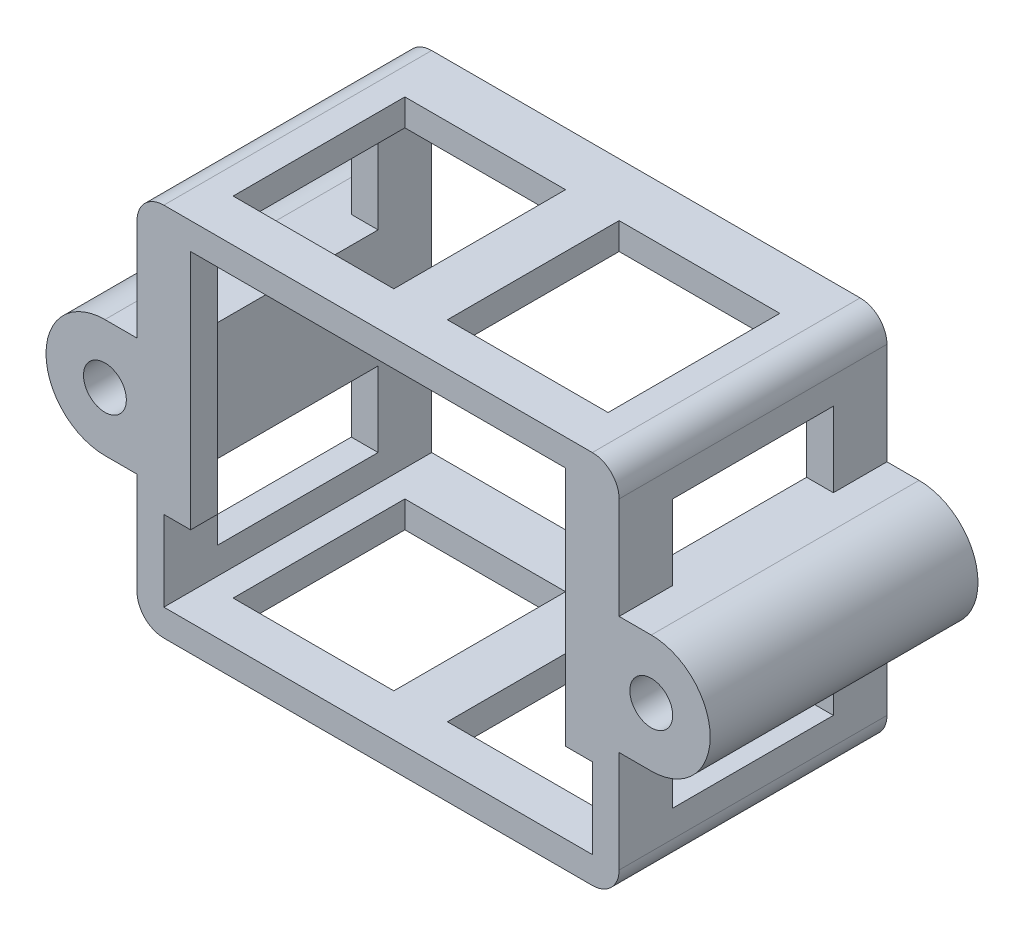
from build123d import *

# Parameters (mm, degrees)
SKETCH_2_W           = 18
SKETCH_2_H           = 14
EXTRUDE_1_DEPTH      = 4
SHELL_1_T            = -1
SKETCH_3_W           = 2.5
SKETCH_3_H           = 2
CUT_EXTRUDE_1_DEPTH  = 4
SKETCH_4_W           = 1.5
SKETCH_4_H           = 6
EXTRUDE_2_DEPTH      = 5
SKETCH_5_W           = 1.5
SKETCH_5_H           = 6
EXTRUDE_3_DEPTH      = 5
SKETCH_6_R           = 1.1
CUT_EXTRUDE_2_DEPTH  = 5
FILLET_1_R           = 3
SKETCH_7_W           = 5.917960412
SKETCH_7_H           = 8.297832083
CUT_EXTRUDE_3_DEPTH  = 10
SKETCH_8_R           = 0.7
EXTRUDE_5_DEPTH      = 3
SKETCH_9_W           = 5.283067479
SKETCH_9_H           = 7.875128382
CUT_EXTRUDE_6_DEPTH  = 3
SKETCH_10_R          = 0.7
EXTRUDE_6_DEPTH      = 3
SKETCH_11_R          = 0.7
EXTRUDE_7_DEPTH      = 1
FILLET_6_R           = 1
SKETCH_12_W          = 30.892671625
SKETCH_12_H          = 21.919086058
CUT_EXTRUDE_7_DEPTH  = 1
SKETCH_13_W          = 18
SKETCH_13_H          = 14
SKETCH_13_W_2        = 16
SKETCH_13_H_2        = 12
EXTRUDE_8_DEPTH      = 2
EXTRUDE_START        = 2
SKETCH_14_R          = 0.7
EXTRUDE_9_DEPTH      = 2
SKETCH_15_W          = 2
SKETCH_15_H          = 10
EXTRUDE_11_DEPTH     = 1
SKETCH_16_W          = 3
SKETCH_16_H          = 3
CUT_EXTRUDE_9_DEPTH  = 82.19627022
SKETCH_17_R          = 1.2
CUT_EXTRUDE_10_DEPTH = 89.625360281
SKETCH_18_W          = 18
SKETCH_18_H          = 14
SKETCH_18_W_2        = 16
SKETCH_18_H_2        = 12
EXTRUDE_12_DEPTH     = 10
SKETCH_19_R          = 1.2
SKETCH_19_R_2        = 0.8
EXTRUDE_14_DEPTH     = 5
SKETCH_20_R          = 0.8
EXTRUDE_15_DEPTH     = 10
SKETCH_21_W          = 2.939386231
SKETCH_21_H          = 10
SKETCH_21_W_2        = 3
SKETCH_21_W_3        = 3.044568854
CUT_EXTRUDE_11_DEPTH = 82.472905297
SKETCH_22_W          = 13
SKETCH_22_H          = 3.8
CUT_EXTRUDE_12_DEPTH = 45.806028471
SKETCH_23_W          = 27.889217439
SKETCH_23_H          = 16.978710397
CUT_EXTRUDE_13_DEPTH = 5
SKETCH_24_W          = 18
SKETCH_24_H          = 14
SKETCH_24_W_2        = 15.99
SKETCH_24_H_2        = 12
EXTRUDE_16_DEPTH     = 2
SKETCH_25_W          = 18
SKETCH_25_H          = 14
SKETCH_25_W_2        = 16
SKETCH_25_H_2        = 12.017260671
EXTRUDE_17_DEPTH     = 2
SKETCH_26_W          = 6
SKETCH_26_H          = 1
EXTRUDE_18_DEPTH     = 1
SKETCH_27_W          = 6
SKETCH_27_H          = 1
EXTRUDE_19_DEPTH     = 1.01
SKETCH_28_W          = 15.99
SKETCH_28_H          = 6
EXTRUDE_20_DEPTH     = 1
EXTRUDE_START_2      = -1
SKETCH_29_W          = 15.99
SKETCH_29_H          = 6
EXTRUDE_21_DEPTH     = 1
SKETCH_30_W          = 6
SKETCH_30_H          = 6.412534926
CUT_EXTRUDE_14_DEPTH = 82.19627022
FILLET_7_R           = 1


# Some blends are built 0.0001 mm under size
with BuildPart() as part:
    # Эскиз2 → Бобышка-Вытянуть1 (new body)
    with BuildSketch(Plane.XY):
        with Locations((-67.35483871, 31.322580645)):
            Rectangle(SKETCH_2_W, SKETCH_2_H)
    extrude(amount=EXTRUDE_1_DEPTH)

    # Оболочка1
    shell_1_openings = [part.faces().sort_by_distance(p)[0] for p in [
        (-67.35483871, 31.322580645, 4),
    ]]
    offset(amount=SHELL_1_T, openings=shell_1_openings, kind=Kind.INTERSECTION)

    # Эскиз3 → Вырез-Вытянуть1 (cut)
    with BuildSketch(Plane.XY.offset(1)):
        with Locations((-69.60483871, 36.322580645)):
            Rectangle(SKETCH_3_W, SKETCH_3_H)
        with Locations((-74.10483871, 36.322580645)):
            Rectangle(SKETCH_3_W, SKETCH_3_H)
        with Locations((-65.10483871, 36.322580645)):
            Rectangle(SKETCH_3_W, SKETCH_3_H)
        with Locations((-60.60483871, 36.322580645)):
            Rectangle(SKETCH_3_W, SKETCH_3_H)
        with Locations((-69.60483871, 32.992580645)):
            Rectangle(SKETCH_3_W, SKETCH_3_H)
        with Locations((-65.10483871, 32.992580645)):
            Rectangle(SKETCH_3_W, SKETCH_3_H)
        with Locations((-60.60483871, 32.992580645)):
            Rectangle(SKETCH_3_W, SKETCH_3_H)
        with Locations((-69.60483871, 29.662580645)):
            Rectangle(SKETCH_3_W, SKETCH_3_H)
        with Locations((-65.10483871, 29.662580645)):
            Rectangle(SKETCH_3_W, SKETCH_3_H)
        with Locations((-60.60483871, 29.662580645)):
            Rectangle(SKETCH_3_W, SKETCH_3_H)
        with Locations((-69.60483871, 26.332580645)):
            Rectangle(SKETCH_3_W, SKETCH_3_H)
        with Locations((-65.10483871, 26.332580645)):
            Rectangle(SKETCH_3_W, SKETCH_3_H)
        with Locations((-60.60483871, 26.332580645)):
            Rectangle(SKETCH_3_W, SKETCH_3_H)
        with Locations((-74.10483871, 32.992580645)):
            Rectangle(SKETCH_3_W, SKETCH_3_H)
        with Locations((-74.10483871, 29.662580645)):
            Rectangle(SKETCH_3_W, SKETCH_3_H)
        with Locations((-74.10483871, 26.332580645)):
            Rectangle(SKETCH_3_W, SKETCH_3_H)
    extrude(amount=-CUT_EXTRUDE_1_DEPTH, mode=Mode.SUBTRACT)

    # Эскиз4 → Бобышка-Вытянуть2 (add)
    with BuildSketch(Plane.ZY.offset(76.35483871)):
        with Locations((3.25, 31.322580645)):
            Rectangle(SKETCH_4_W, SKETCH_4_H)
    extrude(amount=EXTRUDE_2_DEPTH)

    # Эскиз5 → Бобышка-Вытянуть3 (add)
    with BuildSketch(Plane(origin=(-58.35483871, 0, 0), x_dir=(0, 0, -1), z_dir=(1, 0, 0))):
        with Locations((-3.25, 31.322580645)):
            Rectangle(SKETCH_5_W, SKETCH_5_H)
    extrude(amount=EXTRUDE_3_DEPTH)

    # Эскиз6 → Вырез-Вытянуть2 (cut)
    with BuildSketch(Plane(origin=(0, 0, 2.5), x_dir=(-1, 0, 0), z_dir=(0, 0, -1))):
        with Locations(Location((55.85483871, 31.322580645, 0), (0, 0, 90))):
            Circle(SKETCH_6_R)
        with Locations(Location((78.85483871, 31.322580645, 0), (0, 0, 90))):
            Circle(SKETCH_6_R)
    extrude(amount=-CUT_EXTRUDE_2_DEPTH, mode=Mode.SUBTRACT)

    # Скругление1
    fillet_1_edges = [part.edges().sort_by_distance(p)[0] for p in [
        (-81.35483871, 28.322580645, 3.25),
        (-81.35483871, 34.322580645, 3.25),
        (-53.35483871, 28.322580645, 3.25),
        (-53.35483871, 34.322580645, 3.25),
    ]]
    fillet(fillet_1_edges, radius=FILLET_1_R - 0.0001)  # a hair under: the kernel refuses the full size

    # Эскиз7 → Вырез-Вытянуть3 (cut)
    with BuildSketch(Plane.XY.offset(4)):
        with Locations((-79.313818916, 31.798685765)):
            Rectangle(SKETCH_7_W, SKETCH_7_H)
    extrude(amount=-CUT_EXTRUDE_3_DEPTH, mode=Mode.SUBTRACT)

    # Эскиз8 → Бобышка-Вытянуть5 (add)
    with BuildSketch(Plane.XY.offset(4)):
        with BuildLine():
            Line((-77.55483871, 33.522580645), (-76.35483871, 33.522580645))
            Line((-76.35483871, 33.522580645), (-76.35483871, 29.122580645))
            Line((-76.35483871, 29.122580645), (-77.55483871, 29.122580645))
            ThreePointArc((-77.55483871, 29.122580645), (-79.75483871, 31.322580645), (-77.55483871, 33.522580645))
        make_face()
        with Locations((-77.55483871, 31.322580645)):
            Circle(SKETCH_8_R, mode=Mode.SUBTRACT)
    extrude(amount=-EXTRUDE_5_DEPTH)

    # Эскиз9 → Вырез-Вытянуть6 (cut)
    with BuildSketch(Plane.XY.offset(4)):
        with Locations((-55.713304971, 31.190086721)):
            Rectangle(SKETCH_9_W, SKETCH_9_H)
    extrude(amount=-CUT_EXTRUDE_6_DEPTH, mode=Mode.SUBTRACT)

    # Эскиз10 → Бобышка-Вытянуть6 (add)
    with BuildSketch(Plane.XY.offset(4)):
        with BuildLine():
            Line((-57.15483871, 33.522580645), (-58.35483871, 33.522580645))
            Line((-58.35483871, 33.522580645), (-58.35483871, 29.122580645))
            Line((-58.35483871, 29.122580645), (-57.15483871, 29.122580645))
            ThreePointArc((-57.15483871, 29.122580645), (-54.95483871, 31.322580645), (-57.15483871, 33.522580645))
        make_face()
        with Locations((-57.15483871, 31.322580645)):
            Circle(SKETCH_10_R, mode=Mode.SUBTRACT)
    extrude(amount=-EXTRUDE_6_DEPTH)

    # Эскиз11 → Бобышка-Вытянуть7 (add)
    # profile 1 of 2: a face of its own
    with BuildSketch(Plane(origin=(0, 0, 1), x_dir=(-1, 0, 0), z_dir=(0, 0, -1))):
        with BuildLine():
            Line((57.15483871, 33.522580645), (58.35483871, 33.522580645))
            Line((58.35483871, 33.522580645), (58.35483871, 29.122580645))
            Line((58.35483871, 29.122580645), (57.15483871, 29.122580645))
            ThreePointArc((57.15483871, 29.122580645), (54.95483871, 31.322580645), (57.15483871, 33.522580645))
        make_face()
        with Locations(Location((57.15483871, 31.322580645, 0), (0, 0, 180))):
            Circle(SKETCH_11_R, mode=Mode.SUBTRACT)
    # profile 2 of 2: a face of its own
    with BuildSketch(Plane(origin=(0, 0, 1), x_dir=(-1, 0, 0), z_dir=(0, 0, -1))):
        with BuildLine():
            Line((77.55483871, 33.522580645), (76.35483871, 33.522580645))
            Line((76.35483871, 33.522580645), (76.35483871, 29.122580645))
            Line((76.35483871, 29.122580645), (77.55483871, 29.122580645))
            ThreePointArc((77.55483871, 29.122580645), (79.75483871, 31.322580645), (77.55483871, 33.522580645))
        make_face()
        with Locations(Location((77.55483871, 31.322580645, 0), (0, 0, 180))):
            Circle(SKETCH_11_R, mode=Mode.SUBTRACT)
    extrude(amount=EXTRUDE_7_DEPTH)

    # Скругление6
    # the kernel refuses this fillet: 1 mm, written as the material it takes off along each edge
    with BuildSketch(Plane(origin=(-76.35483871, 29.122580645, 0), x_dir=(1, 0, 0), z_dir=(0, -1, 0))) as fillet_6_piece_1:
        with BuildLine():
            CenterArc((FILLET_6_R, FILLET_6_R), FILLET_6_R, 180, 90)
            Line((0, FILLET_6_R), (-FILLET_6_R * 0.02, FILLET_6_R))
            Line((-FILLET_6_R * 0.02, FILLET_6_R), (-FILLET_6_R * 0.02, -FILLET_6_R * 0.02))
            Line((-FILLET_6_R * 0.02, -FILLET_6_R * 0.02), (FILLET_6_R, -FILLET_6_R * 0.02))
            Line((FILLET_6_R, -FILLET_6_R * 0.02), (FILLET_6_R, 0))
        make_face()
    extrude(amount=4.8, mode=Mode.SUBTRACT)
    with BuildSketch(Plane(origin=(-77.55483871, 31.322580645, 0), x_dir=(0, -1, 0), z_dir=(1, 0, 0))) as fillet_6_piece_2:
        with BuildLine():
            CenterArc((2.2 - FILLET_6_R, -FILLET_6_R), FILLET_6_R, 0, 90)
            Line((2.2, -FILLET_6_R), (2.2 + FILLET_6_R * 0.02, -FILLET_6_R))
            Line((2.2 + FILLET_6_R * 0.02, -FILLET_6_R), (2.2 + FILLET_6_R * 0.02, FILLET_6_R * 0.02))
            Line((2.2 + FILLET_6_R * 0.02, FILLET_6_R * 0.02), (2.2 - FILLET_6_R, FILLET_6_R * 0.02))
            Line((2.2 - FILLET_6_R, FILLET_6_R * 0.02), (2.2 - FILLET_6_R, 0))
        make_face()
    revolve(axis=Axis((-77.55483871, 31.322580645, 0), (0, 0, -1)), revolution_arc=180, mode=Mode.SUBTRACT)
    with BuildSketch(Plane(origin=(-77.55483871, 33.522580645, 0), x_dir=(0, -1, 0), z_dir=(1, 0, 0)), Plane(origin=(-76.35483871, 29.122580645, 0), x_dir=(0, 1, 0), z_dir=(-1, 0, 0))) as fillet_6_piece_3:
        with BuildLine():
            CenterArc((FILLET_6_R, -FILLET_6_R), FILLET_6_R, 90, 90)
            Line((0, -FILLET_6_R), (-FILLET_6_R * 0.02, -FILLET_6_R))
            Line((-FILLET_6_R * 0.02, -FILLET_6_R), (-FILLET_6_R * 0.02, FILLET_6_R * 0.02))
            Line((-FILLET_6_R * 0.02, FILLET_6_R * 0.02), (FILLET_6_R, FILLET_6_R * 0.02))
            Line((FILLET_6_R, FILLET_6_R * 0.02), (FILLET_6_R, 0))
        make_face()
    extrude(amount=1.2, mode=Mode.SUBTRACT)
    with BuildSketch(Plane(origin=(-58.35483871, 38.322580645, 0), x_dir=(-1, 0, 0), z_dir=(0, -1, 0))) as fillet_6_piece_4:
        with BuildLine():
            CenterArc((FILLET_6_R, -FILLET_6_R), FILLET_6_R, 90, 90)
            Line((0, -FILLET_6_R), (-FILLET_6_R * 0.02, -FILLET_6_R))
            Line((-FILLET_6_R * 0.02, -FILLET_6_R), (-FILLET_6_R * 0.02, FILLET_6_R * 0.02))
            Line((-FILLET_6_R * 0.02, FILLET_6_R * 0.02), (FILLET_6_R, FILLET_6_R * 0.02))
            Line((FILLET_6_R, FILLET_6_R * 0.02), (FILLET_6_R, 0))
        make_face()
    extrude(amount=4.8, mode=Mode.SUBTRACT)
    with BuildSketch(Plane(origin=(-57.15483871, 31.322580645, 0), x_dir=(0, -1, 0), z_dir=(-1, 0, 0))) as fillet_6_piece_5:
        with BuildLine():
            CenterArc((2.2 - FILLET_6_R, FILLET_6_R), FILLET_6_R, 270, 90)
            Line((2.2, FILLET_6_R), (2.2 + FILLET_6_R * 0.02, FILLET_6_R))
            Line((2.2 + FILLET_6_R * 0.02, FILLET_6_R), (2.2 + FILLET_6_R * 0.02, -FILLET_6_R * 0.02))
            Line((2.2 + FILLET_6_R * 0.02, -FILLET_6_R * 0.02), (2.2 - FILLET_6_R, -FILLET_6_R * 0.02))
            Line((2.2 - FILLET_6_R, -FILLET_6_R * 0.02), (2.2 - FILLET_6_R, 0))
        make_face()
    revolve(axis=Axis((-57.15483871, 31.322580645, 0), (0, 0, 1)), revolution_arc=180, mode=Mode.SUBTRACT)
    with BuildSketch(Plane(origin=(-58.35483871, 29.122580645, 0), x_dir=(0, 1, 0), z_dir=(1, 0, 0)), Plane(origin=(-57.15483871, 33.522580645, 0), x_dir=(0, -1, 0), z_dir=(-1, 0, 0))) as fillet_6_piece_6:
        with BuildLine():
            CenterArc((FILLET_6_R, FILLET_6_R), FILLET_6_R, 180, 90)
            Line((0, FILLET_6_R), (-FILLET_6_R * 0.02, FILLET_6_R))
            Line((-FILLET_6_R * 0.02, FILLET_6_R), (-FILLET_6_R * 0.02, -FILLET_6_R * 0.02))
            Line((-FILLET_6_R * 0.02, -FILLET_6_R * 0.02), (FILLET_6_R, -FILLET_6_R * 0.02))
            Line((FILLET_6_R, -FILLET_6_R * 0.02), (FILLET_6_R, 0))
        make_face()
    extrude(amount=1.2, mode=Mode.SUBTRACT)
    with BuildSketch(Plane(origin=(-76.35483871, 31.622580645, 0), x_dir=(1, 0, 0), z_dir=(0, -1, 0))) as fillet_6_piece_7a_section:
        with BuildLine():
            CenterArc((FILLET_6_R, FILLET_6_R), FILLET_6_R, 180, 90)
            Line((0, FILLET_6_R), (-FILLET_6_R * 0.02, FILLET_6_R))
            Line((-FILLET_6_R * 0.02, FILLET_6_R), (-FILLET_6_R * 0.02, -FILLET_6_R * 0.02))
            Line((-FILLET_6_R * 0.02, -FILLET_6_R * 0.02), (FILLET_6_R, -FILLET_6_R * 0.02))
            Line((FILLET_6_R, -FILLET_6_R * 0.02), (FILLET_6_R, 0))
        make_face()
    fillet_6_piece_7a = extrude(amount=7.3, mode=Mode.PRIVATE)
    fillet_6_piece_7a = split(fillet_6_piece_7a, bisect_by=Plane(origin=(-76.128443595, 29.122580645, 0.226395114), z_dir=(0, 1, 0)), keep=Keep.TOP, mode=Mode.PRIVATE)
    with BuildSketch(Plane(origin=(-73.85483871, 29.122580645, 0), x_dir=(0, 1, 0), z_dir=(-1, 0, 0))) as fillet_6_piece_7b_section:
        with BuildLine():
            CenterArc((FILLET_6_R, -FILLET_6_R), FILLET_6_R, 90, 90)
            Line((0, -FILLET_6_R), (-FILLET_6_R * 0.02, -FILLET_6_R))
            Line((-FILLET_6_R * 0.02, -FILLET_6_R), (-FILLET_6_R * 0.02, FILLET_6_R * 0.02))
            Line((-FILLET_6_R * 0.02, FILLET_6_R * 0.02), (FILLET_6_R, FILLET_6_R * 0.02))
            Line((FILLET_6_R, FILLET_6_R * 0.02), (FILLET_6_R, 0))
        make_face()
    fillet_6_piece_7b = extrude(amount=3.7, mode=Mode.PRIVATE)
    fillet_6_piece_7b = split(fillet_6_piece_7b, bisect_by=Plane(origin=(-76.35483871, 29.348975759, 0.226395114), z_dir=(1, 0, 0)), keep=Keep.TOP, mode=Mode.PRIVATE)
    fillet_6_piece_7 = fillet_6_piece_7a & fillet_6_piece_7b
    add(fillet_6_piece_7, mode=Mode.SUBTRACT)
    with BuildSketch(Plane(origin=(-57.15483871, 33.522580645, 0), x_dir=(0, -1, 0), z_dir=(-1, 0, 0))) as fillet_6_piece_8a_section:
        with BuildLine():
            CenterArc((FILLET_6_R, FILLET_6_R), FILLET_6_R, 180, 90)
            Line((0, FILLET_6_R), (-FILLET_6_R * 0.02, FILLET_6_R))
            Line((-FILLET_6_R * 0.02, FILLET_6_R), (-FILLET_6_R * 0.02, -FILLET_6_R * 0.02))
            Line((-FILLET_6_R * 0.02, -FILLET_6_R * 0.02), (FILLET_6_R, -FILLET_6_R * 0.02))
            Line((FILLET_6_R, -FILLET_6_R * 0.02), (FILLET_6_R, 0))
        make_face()
    fillet_6_piece_8a = extrude(amount=3.7, mode=Mode.PRIVATE)
    fillet_6_piece_8a = split(fillet_6_piece_8a, bisect_by=Plane(origin=(-58.35483871, 33.296185531, 0.226395114), z_dir=(-1, 0, 0)), keep=Keep.TOP, mode=Mode.PRIVATE)
    with BuildSketch(Plane(origin=(-58.35483871, 38.322580645, 0), x_dir=(-1, 0, 0), z_dir=(0, -1, 0))) as fillet_6_piece_8b_section:
        with BuildLine():
            CenterArc((FILLET_6_R, -FILLET_6_R), FILLET_6_R, 90, 90)
            Line((0, -FILLET_6_R), (-FILLET_6_R * 0.02, -FILLET_6_R))
            Line((-FILLET_6_R * 0.02, -FILLET_6_R), (-FILLET_6_R * 0.02, FILLET_6_R * 0.02))
            Line((-FILLET_6_R * 0.02, FILLET_6_R * 0.02), (FILLET_6_R, FILLET_6_R * 0.02))
            Line((FILLET_6_R, FILLET_6_R * 0.02), (FILLET_6_R, 0))
        make_face()
    fillet_6_piece_8b = extrude(amount=7.3, mode=Mode.PRIVATE)
    fillet_6_piece_8b = split(fillet_6_piece_8b, bisect_by=Plane(origin=(-58.581233824, 33.522580645, 0.226395114), z_dir=(0, -1, 0)), keep=Keep.TOP, mode=Mode.PRIVATE)
    fillet_6_piece_8 = fillet_6_piece_8a & fillet_6_piece_8b
    add(fillet_6_piece_8, mode=Mode.SUBTRACT)

    # Эскиз12 → Вырез-Вытянуть7 (cut)
    with BuildSketch(Plane(origin=(0, 0, 0), x_dir=(-1, 0, 0), z_dir=(0, 0, -1))):
        with Locations((68.526392305, 30.136365087)):
            Rectangle(SKETCH_12_W, SKETCH_12_H)
    extrude(amount=-CUT_EXTRUDE_7_DEPTH, mode=Mode.SUBTRACT)

    # Эскиз13 → Бобышка-Вытянуть8 (add)
    with BuildSketch(Plane.XY.offset(4)):
        with Locations((-67.35483871, 31.322580645)):
            Rectangle(SKETCH_13_W, SKETCH_13_H)
        with Locations((-67.35483871, 31.322580645)):
            Rectangle(SKETCH_13_W_2, SKETCH_13_H_2, mode=Mode.SUBTRACT)
    extrude(amount=EXTRUDE_8_DEPTH)

    # Эскиз14 → Бобышка-Вытянуть9 (add)
    # profile 1 of 2: a face of its own
    with BuildSketch(Plane.XY.offset(4).offset(EXTRUDE_START)):
        with BuildLine():
            Line((-77.55483871, 33.522580645), (-76.35483871, 33.522580645))
            Line((-76.35483871, 33.522580645), (-76.35483871, 29.122580645))
            Line((-76.35483871, 29.122580645), (-77.55483871, 29.122580645))
            ThreePointArc((-77.55483871, 29.122580645), (-79.75483871, 31.322580645), (-77.55483871, 33.522580645))
        make_face()
        with Locations((-77.55483871, 31.322580645)):
            Circle(SKETCH_14_R, mode=Mode.SUBTRACT)
    # profile 2 of 2: a face of its own
    with BuildSketch(Plane.XY.offset(4).offset(EXTRUDE_START)):
        with BuildLine():
            Line((-57.15483871, 33.522580645), (-58.35483871, 33.522580645))
            Line((-58.35483871, 33.522580645), (-58.35483871, 29.122580645))
            Line((-58.35483871, 29.122580645), (-57.15483871, 29.122580645))
            ThreePointArc((-57.15483871, 29.122580645), (-54.95483871, 31.322580645), (-57.15483871, 33.522580645))
        make_face()
        with Locations((-57.15483871, 31.322580645)):
            Circle(SKETCH_14_R, mode=Mode.SUBTRACT)
    extrude(amount=-EXTRUDE_9_DEPTH)

    # Эскиз15 → Бобышка-Вытянуть11 (add)
    with BuildSketch(Plane.XY.offset(6)):
        with Locations((-59.35483871, 33.322580645)):
            Rectangle(SKETCH_15_W, SKETCH_15_H)
        with Locations((-75.35483871, 33.322580645)):
            Rectangle(SKETCH_15_W, SKETCH_15_H)
    extrude(amount=-EXTRUDE_11_DEPTH)

    # Эскиз16 → Вырез-Вытянуть9 (cut, through all)
    with BuildSketch(Plane(origin=(0, 38.322580645, 0), x_dir=(1, 0, 0), z_dir=(0, 1, 0))):
        with Locations((-73.85483871, -3.5)):
            Rectangle(SKETCH_16_W, SKETCH_16_H)
        with Locations((-69.52483871, -3.5)):
            Rectangle(SKETCH_16_W, SKETCH_16_H)
        with Locations((-65.19483871, -3.5)):
            Rectangle(SKETCH_16_W, SKETCH_16_H)
        with Locations((-60.86483871, -3.5)):
            Rectangle(SKETCH_16_W, SKETCH_16_H)
    extrude(amount=-CUT_EXTRUDE_9_DEPTH, mode=Mode.SUBTRACT)

    # Эскиз17 → Вырез-Вытянуть10 (cut, through all)
    with BuildSketch(Plane(origin=(0, 0, 1), x_dir=(-1, 0, 0), z_dir=(0, 0, -1))):
        with Locations((57.15483871, 31.322580645)):
            Circle(SKETCH_17_R)
        with Locations((77.55483871, 31.322580645)):
            Circle(SKETCH_17_R)
    extrude(amount=-CUT_EXTRUDE_10_DEPTH, mode=Mode.SUBTRACT)

    # Эскиз18 → Бобышка-Вытянуть12 (add)
    with BuildSketch(Plane(origin=(0, 0, 1), x_dir=(-1, 0, 0), z_dir=(0, 0, -1))):
        with Locations((67.35483871, 31.322580645)):
            Rectangle(SKETCH_18_W, SKETCH_18_H)
        with Locations((67.35483871, 31.322580645)):
            Rectangle(SKETCH_18_W_2, SKETCH_18_H_2, mode=Mode.SUBTRACT)
    extrude(amount=EXTRUDE_12_DEPTH)

    # Эскиз19 → Бобышка-Вытянуть14 (add)
    # profile 1 of 2: a face of its own
    with BuildSketch(Plane(origin=(0, 0, 1), x_dir=(-1, 0, 0), z_dir=(0, 0, -1))):
        with Locations((57.15483871, 31.322580645)):
            Circle(SKETCH_19_R)
        with Locations((57.15483871, 31.322580645)):
            Circle(SKETCH_19_R_2, mode=Mode.SUBTRACT)
    # profile 2 of 2: a face of its own
    with BuildSketch(Plane(origin=(0, 0, 1), x_dir=(-1, 0, 0), z_dir=(0, 0, -1))):
        with Locations((77.55483871, 31.322580645)):
            Circle(SKETCH_19_R)
        with Locations((77.55483871, 31.322580645)):
            Circle(SKETCH_19_R_2, mode=Mode.SUBTRACT)
    extrude(amount=-EXTRUDE_14_DEPTH)

    # Эскиз20 → Бобышка-Вытянуть15 (add)
    # profile 1 of 2: a face of its own
    with BuildSketch(Plane(origin=(0, 0, 1), x_dir=(-1, 0, 0), z_dir=(0, 0, -1))):
        with BuildLine():
            Line((77.55483871, 33.522580645), (76.35483871, 33.522580645))
            Line((76.35483871, 33.522580645), (76.35483871, 29.122580645))
            Line((76.35483871, 29.122580645), (77.55483871, 29.122580645))
            ThreePointArc((77.55483871, 29.122580645), (79.75483871, 31.322580645), (77.55483871, 33.522580645))
        make_face()
        with Locations((77.55483871, 31.322580645)):
            Circle(SKETCH_20_R, mode=Mode.SUBTRACT)
    # profile 2 of 2: a face of its own
    with BuildSketch(Plane(origin=(0, 0, 1), x_dir=(-1, 0, 0), z_dir=(0, 0, -1))):
        with BuildLine():
            Line((57.15483871, 33.522580645), (58.35483871, 33.522580645))
            Line((58.35483871, 33.522580645), (58.35483871, 29.122580645))
            Line((58.35483871, 29.122580645), (57.15483871, 29.122580645))
            ThreePointArc((57.15483871, 29.122580645), (54.95483871, 31.322580645), (57.15483871, 33.522580645))
        make_face()
        with Locations((57.15483871, 31.322580645)):
            Circle(SKETCH_20_R, mode=Mode.SUBTRACT)
    extrude(amount=EXTRUDE_15_DEPTH)

    # Эскиз21 → Вырез-Вытянуть11 (cut, through all)
    with BuildSketch(Plane.XZ.offset(-24.322580645)):
        with Locations((-73.885145595, -3)):
            Rectangle(SKETCH_21_W, SKETCH_21_H)
        with Locations((-69.52483871, -3)):
            Rectangle(SKETCH_21_W_2, SKETCH_21_H)
        with Locations((-65.172554283, -3)):
            Rectangle(SKETCH_21_W_3, SKETCH_21_H)
        with Locations((-60.86483871, -3)):
            Rectangle(SKETCH_21_W_2, SKETCH_21_H)
    extrude(amount=-CUT_EXTRUDE_11_DEPTH, mode=Mode.SUBTRACT)

    # Эскиз22 → Вырез-Вытянуть12 (cut, through all)
    with BuildSketch(Plane.ZY.offset(76.35483871)):
        with Locations((-1.5, 27.222580645)):
            Rectangle(SKETCH_22_W, SKETCH_22_H)
        with Locations((-1.5, 35.422580645)):
            Rectangle(SKETCH_22_W, SKETCH_22_H)
    extrude(amount=-CUT_EXTRUDE_12_DEPTH, mode=Mode.SUBTRACT)

    # Эскиз23 → Вырез-Вытянуть13 (cut)
    with BuildSketch(Plane(origin=(0, 0, -9), x_dir=(-1, 0, 0), z_dir=(0, 0, -1))):
        with Locations((67.449459052, 30.98965987)):
            Rectangle(SKETCH_23_W, SKETCH_23_H)
    extrude(amount=-CUT_EXTRUDE_13_DEPTH, mode=Mode.SUBTRACT)

    # Эскиз24 → Бобышка-Вытянуть16 (add)
    with BuildSketch(Plane(origin=(0, 0, -4), x_dir=(-1, 0, 0), z_dir=(0, 0, -1))):
        with Locations((67.35483871, 31.322580645)):
            Rectangle(SKETCH_24_W, SKETCH_24_H)
        with Locations((67.35983871, 31.322580645)):
            Rectangle(SKETCH_24_W_2, SKETCH_24_H_2, mode=Mode.SUBTRACT)
    extrude(amount=-EXTRUDE_16_DEPTH)

    # Эскиз25 → Бобышка-Вытянуть17 (add)
    with BuildSketch(Plane.XY.offset(6)):
        with Locations((-67.35483871, 31.322580645)):
            Rectangle(SKETCH_25_W, SKETCH_25_H)
        with Locations((-67.35483871, 31.331210981)):
            Rectangle(SKETCH_25_W_2, SKETCH_25_H_2, mode=Mode.SUBTRACT)
    extrude(amount=-EXTRUDE_17_DEPTH)

    # Эскиз26 → Бобышка-Вытянуть18 (add)
    with BuildSketch(Plane.ZY.offset(76.35483871)):
        with Locations((1, 36.822580645)):
            Rectangle(SKETCH_26_W, SKETCH_26_H)
        with Locations((1, 25.822580645)):
            Rectangle(SKETCH_26_W, SKETCH_26_H)
    extrude(amount=-EXTRUDE_18_DEPTH)

    # Эскиз27 → Бобышка-Вытянуть19 (add)
    with BuildSketch(Plane(origin=(-58.35483871, 0, 0), x_dir=(0, 0, -1), z_dir=(1, 0, 0))):
        with Locations((-1, 36.822580645)):
            Rectangle(SKETCH_27_W, SKETCH_27_H)
        with Locations((-1, 25.822580645)):
            Rectangle(SKETCH_27_W, SKETCH_27_H)
    extrude(amount=-EXTRUDE_19_DEPTH)

    # Эскиз28 → Бобышка-Вытянуть20 (add)
    with BuildSketch(Plane(origin=(0, 38.322580645, 0), x_dir=(1, 0, 0), z_dir=(0, 1, 0))):
        with Locations((-67.35983871, -1)):
            Rectangle(SKETCH_28_W, SKETCH_28_H)
    extrude(amount=-EXTRUDE_20_DEPTH)

    # Эскиз29 → Бобышка-Вытянуть21 (add)
    with BuildSketch(Plane.XZ.offset(-24.322580645).offset(EXTRUDE_START_2)):
        with Locations((-67.35983871, 1)):
            Rectangle(SKETCH_29_W, SKETCH_29_H)
    extrude(amount=EXTRUDE_21_DEPTH)

    # Эскиз30 → Вырез-Вытянуть14 (cut, through all)
    with BuildSketch(Plane.XZ.offset(-24.322580645)):
        with Locations((-71.35483871, 1.206267463)):
            Rectangle(SKETCH_30_W, SKETCH_30_H)
        with Locations((-63.35483871, 1.206267463)):
            Rectangle(SKETCH_30_W, SKETCH_30_H)
    extrude(amount=-CUT_EXTRUDE_14_DEPTH, mode=Mode.SUBTRACT)

    # Скругление7
    fillet_7_edges = [part.edges().sort_by_distance(p)[0] for p in [
        (-76.35483871, 38.322580645, 1),
        (-58.35483871, 38.322580645, 1),
        (-58.35483871, 24.322580645, 1),
        (-76.35483871, 24.322580645, 1),
    ]]
    fillet(fillet_7_edges, radius=FILLET_7_R)


solid = part.part
